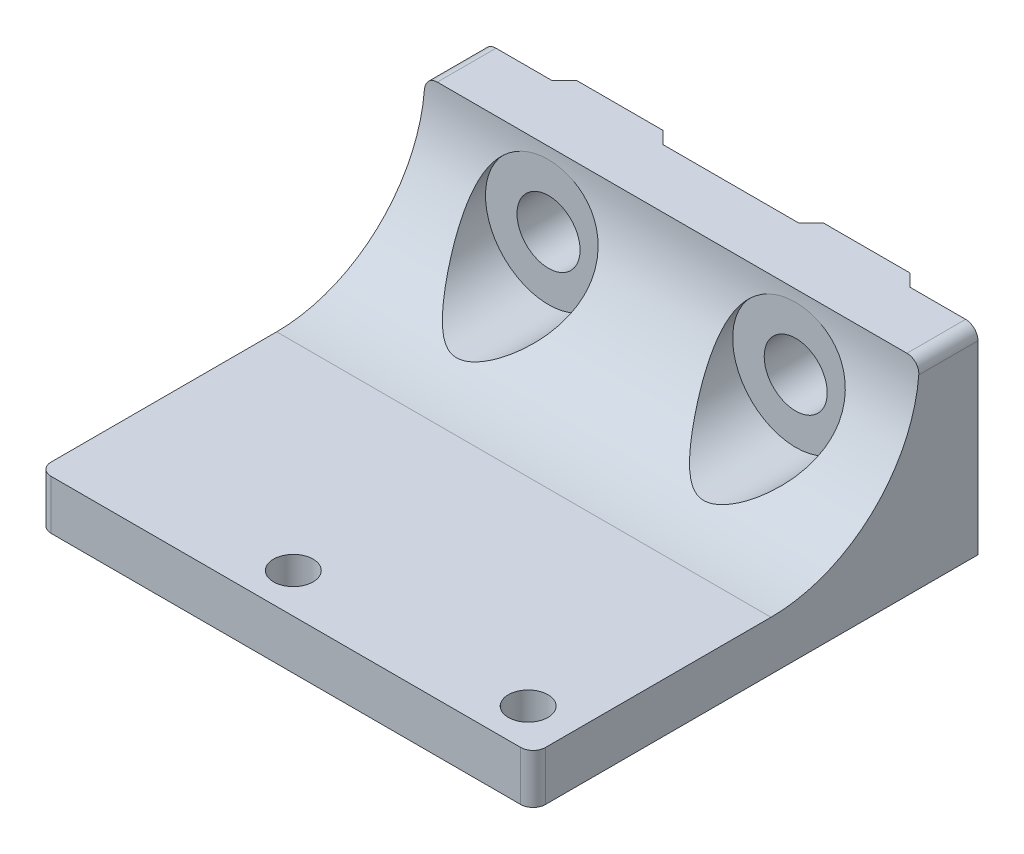
from build123d import *

# Parameters (mm, degrees)
BOSS_EXTRUDE1_DEPTH = 4
BOSS_EXTRUDE2_DEPTH = 40
SKETCH3_W           = 9
SKETCH3_H           = 16
BOSS_EXTRUDE3_DEPTH = 1
CHAMFER1_SIZE       = 1
SKETCH4_R           = 5.1
CUT_EXTRUDE1_DEPTH  = 31.25
CUT_EXTRUDE2_REACH  = 58.789
SKETCH5_R           = 2.55
FILLET1_R           = 1
SKETCH6_R           = 1.6
CUT_EXTRUDE3_DEPTH  = 56.794265031
SKETCH7_W           = 3
SKETCH7_H           = 3.5
CUT_EXTRUDE4_DEPTH  = 1.5
CHAMFER2_SIZE       = 1
SKETCH8_W           = 3.5
SKETCH8_H           = 9.5
CUT_EXTRUDE5_DEPTH  = 2
CHAMFER3_SIZE       = 1.5


with BuildPart() as part:
    # Sketch1 → Boss-Extrude1 (new body)
    with BuildSketch(Plane(origin=(0, 0, 0), x_dir=(1, 0, 0), z_dir=(0, 1, 0))):
        with BuildLine():
            Line((1, 0), (39, 0))
            ThreePointArc((39, 0), (39.707106781, 0.292893219), (40, 1))
            Line((40, 1), (40, 36))
            Line((40, 36), (0, 36))
            Line((0, 36), (0, 1))
            ThreePointArc((0, 1), (0.292893219, 0.292893219), (1, 0))
        make_face()
    extrude(amount=BOSS_EXTRUDE1_DEPTH)

    # Sketch2 → Boss-Extrude2 (add, through all)
    with BuildSketch(Plane(origin=(40, 0, 0), x_dir=(0, 0, -1), z_dir=(1, 0, 0))):
        with BuildLine():
            Line((36, 0), (36, 16))
            Line((36, 16), (31.25, 16))
            ThreePointArc((31.25, 16), (27.735281374, 7.514718626), (19.25, 4))
            Line((19.25, 4), (19.25, 0))
            Line((19.25, 0), (36, 0))
        make_face()
    extrude(amount=-BOSS_EXTRUDE2_DEPTH)

    # Sketch3 → Boss-Extrude3 (add)
    with BuildSketch(Plane(origin=(0, 0, -36), x_dir=(-1, 0, 0), z_dir=(0, 0, -1))):
        with Locations((-30, 8)):
            Rectangle(SKETCH3_W, SKETCH3_H)
        with Locations((-10, 8)):
            Rectangle(SKETCH3_W, SKETCH3_H)
    extrude(amount=BOSS_EXTRUDE3_DEPTH)

    # Chamfer1
    chamfer1_edges = [part.edges().sort_by_distance(p)[0] for p in [
        (25.5, 8, -37),
        (34.5, 8, -37),
        (14.5, 8, -37),
        (5.5, 8, -37),
    ]]
    chamfer(chamfer1_edges, length=CHAMFER1_SIZE - 0.0001)  # a hair under: the kernel refuses the full size

    # Sketch4 → Cut-Extrude1 (cut)
    with BuildSketch(Plane.XY):
        with Locations((10, 10)):
            Circle(SKETCH4_R)
        with Locations((30, 10)):
            Circle(SKETCH4_R)
    extrude(amount=-CUT_EXTRUDE1_DEPTH, mode=Mode.SUBTRACT)

    # Sketch5 → Cut-Extrude2 (cut, up to next)
    with BuildSketch(Plane(origin=(0, 0, -37), x_dir=(-1, 0, 0), z_dir=(0, 0, -1)), mode=Mode.PRIVATE) as cut_extrude2_sk1:
        with Locations((-30, 10)):
            Circle(SKETCH5_R)
    cut_extrude2_tool1 = extrude(cut_extrude2_sk1.sketch, amount=-CUT_EXTRUDE2_REACH, mode=Mode.PRIVATE) & part.part
    # Sketch5 → Cut-Extrude2 (cut, up to next)
    with BuildSketch(Plane(origin=(0, 0, -37), x_dir=(-1, 0, 0), z_dir=(0, 0, -1)), mode=Mode.PRIVATE) as cut_extrude2_sk2:
        with Locations((-10, 10)):
            Circle(SKETCH5_R)
    cut_extrude2_tool2 = extrude(cut_extrude2_sk2.sketch, amount=-CUT_EXTRUDE2_REACH, mode=Mode.PRIVATE) & part.part
    add(cut_extrude2_tool1.solids().sort_by_distance((30, 10, -37))[0], mode=Mode.SUBTRACT)
    add(cut_extrude2_tool2.solids().sort_by_distance((10, 10, -37))[0], mode=Mode.SUBTRACT)

    # Fillet1
    fillet1_edges = [part.edges().sort_by_distance(p)[0] for p in [
        (0, 16, -33.625),
        (40, 16, -33.625),
    ]]
    fillet(fillet1_edges, radius=FILLET1_R)

    # Sketch6 → Cut-Extrude3 (cut, through all)
    with BuildSketch(Plane(origin=(0, 4, 0), x_dir=(1, 0, 0), z_dir=(0, 1, 0))):
        with Locations(Location((36.4, 3.2, 0), (0, 0, 270))):
            Circle(SKETCH6_R)
        with Locations(Location((17.4, 3.2, 0), (0, 0, 270))):
            Circle(SKETCH6_R)
    extrude(amount=-CUT_EXTRUDE3_DEPTH, mode=Mode.SUBTRACT)

    # Sketch7 → Cut-Extrude4 (cut)
    with BuildSketch(Plane.XZ):
        with Locations((31.5, -9.5)):
            Rectangle(SKETCH7_W, SKETCH7_H)
        with Locations((26.75, -9.5)):
            Rectangle(SKETCH7_W, SKETCH7_H)
        with Locations((22, -9.5)):
            Rectangle(SKETCH7_W, SKETCH7_H)
    extrude(amount=-CUT_EXTRUDE4_DEPTH, mode=Mode.SUBTRACT)

    # Chamfer2
    chamfer2_edges = [part.edges().sort_by_distance(p)[0] for p in [
        (33, 1.5, -9.5),
        (30, 1.5, -9.5),
        (28.25, 1.5, -9.5),
        (25.25, 1.5, -9.5),
        (23.5, 1.5, -9.5),
        (20.5, 1.5, -9.5),
    ]]
    chamfer(chamfer2_edges, length=CHAMFER2_SIZE)

    # Sketch8 → Cut-Extrude5 (cut)
    with BuildSketch(Plane.XZ):
        with Locations((11.25, -8.5)):
            Rectangle(SKETCH8_W, SKETCH8_H)
    extrude(amount=-CUT_EXTRUDE5_DEPTH, mode=Mode.SUBTRACT)

    # Chamfer3
    chamfer3_edges = [part.edges().sort_by_distance(p)[0] for p in [
        (9.5, 2, -8.5),
        (13, 2, -8.5),
    ]]
    chamfer(chamfer3_edges, length=CHAMFER3_SIZE)


solid = part.part
